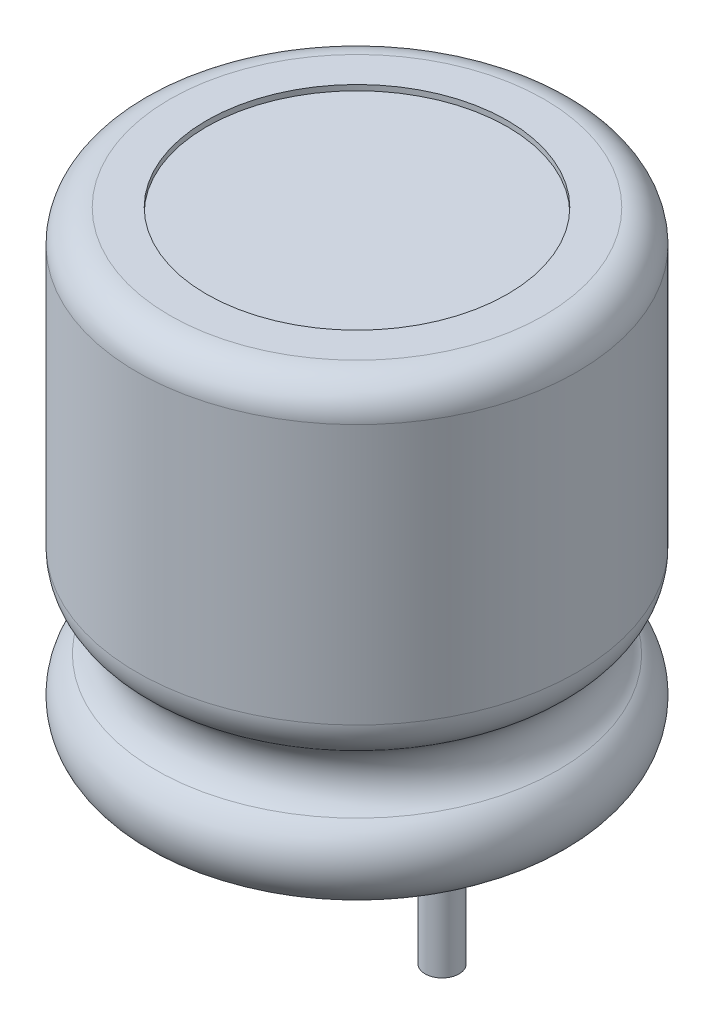
from build123d import *

# Parameters (mm, degrees)
SKETCH4_R              = 2.2
CUT_EXTRUDE1_DEPTH     = 0.33
BOSS_EXTRUDE1_DEPTH    = 0.5
CUT_EXTRUDE2_START     = -0.3
CUT_EXTRUDE2_DEPTH     = 0.3
SKETCH7_R              = 0.605
CUT_EXTRUDE3_DEPTH     = 0.6
SKETCH8_R              = 0.6
BOSS_EXTRUDE2_DEPTH    = 0.6
CHAMFER1_SIZE          = 0.35
SKETCH9_R              = 0.25
BOSS_EXTRUDE3_DEPTH    = 2.5
SKETCH10_R             = 3.23
BOSS_EXTRUDE4_DEPTH    = 4
FILLET1_R              = 0.48
SKETCH11_R             = 2.21
CUT_EXTRUDE4_DEPTH     = 0.08
SPLIT1_SURFACE_1_BACK  = 13.824
SPLIT1_SURFACE_1_DEPTH = 27.648
SPLIT1_SURFACE_2_BACK  = 13.824
SPLIT1_SURFACE_2_DEPTH = 27.648


with BuildPart() as part:
    # Sketch3 → Revolve1 (revolve)
    with BuildSketch(Plane.XY, mode=Mode.PRIVATE) as revolve1_sk:
        with BuildLine():
            Line((2.599137675, 0.17), (0, 0.17))
            Line((0, 0.17), (0, 3))
            Line((0, 3), (3.23, 3))
            Line((3.23, 3), (3.23, 2.699137675))
            ThreePointArc((3.23, 2.699137675), (3.157289203, 2.405106817), (2.955917553, 2.178853721))
            ThreePointArc((2.955917553, 2.178853721), (2.73, 1.75), (2.955917553, 1.321146279))
            ThreePointArc((2.955917553, 1.321146279), (3.201721618, 0.614100808), (2.599137675, 0.17))
        make_face()
    revolve(revolve1_sk.sketch.rotate(Axis((0, 3, 0), (0, -1, 0)), 180), axis=Axis((0, 3, 0), (0, -1, 0)))

    # Sketch4 → Cut-Extrude1 (cut)
    with BuildSketch(Plane.XZ.offset(-0.17)):
        Circle(SKETCH4_R)
    extrude(amount=-CUT_EXTRUDE1_DEPTH, mode=Mode.SUBTRACT)

    # Sketch5 → Boss-Extrude1 (add)
    with BuildSketch(Plane.XZ.offset(-0.5)):
        with BuildLine():
            ThreePointArc((1.3, 1.519868415), (0, 2), (-1.3, 1.519868415))
            ThreePointArc((-1.3, 1.519868415), (-1.391785902, 1.203832227), (-1.138461538, 0.993760118))
            ThreePointArc((-1.138461538, 0.993760118), (-0.25, 0), (-1.138461538, -0.993760118))
            ThreePointArc((-1.138461538, -0.993760118), (-1.391785902, -1.203832227), (-1.3, -1.519868415))
            ThreePointArc((-1.3, -1.519868415), (0, -2), (1.3, -1.519868415))
            ThreePointArc((1.3, -1.519868415), (1.391785902, -1.203832227), (1.138461538, -0.993760118))
            ThreePointArc((1.138461538, -0.993760118), (0.25, 0), (1.138461538, 0.993760118))
            ThreePointArc((1.138461538, 0.993760118), (1.391785902, 1.203832227), (1.3, 1.519868415))
        make_face()
    extrude(amount=BOSS_EXTRUDE1_DEPTH)

    # Sketch6 → Cut-Extrude2 (cut)
    with BuildSketch(Plane.XZ.offset(CUT_EXTRUDE2_START)):
        with BuildLine():
            Line((0.383974596, -0.5), (-0.383974596, -0.5))
            ThreePointArc((-0.383974596, -0.5), (-0.25, 0), (-0.383974596, 0.5))
            Line((-0.383974596, 0.5), (0.383974596, 0.5))
            ThreePointArc((0.383974596, 0.5), (0.25, 0), (0.383974596, -0.5))
        make_face()
    extrude(amount=CUT_EXTRUDE2_DEPTH, mode=Mode.SUBTRACT)

    # Sketch7 → Cut-Extrude3 (cut)
    with BuildSketch(Plane.XZ.offset(-0.5)):
        with Locations((-1.25, 0)):
            Circle(SKETCH7_R)
        with Locations((1.25, 0)):
            Circle(SKETCH7_R)
    extrude(amount=-CUT_EXTRUDE3_DEPTH, mode=Mode.SUBTRACT)

    # Sketch8 → Boss-Extrude2 (add)
    with BuildSketch(Plane.XZ.offset(-1.1)):
        with Locations((-1.25, 0)):
            Circle(SKETCH8_R)
        with Locations((1.25, 0)):
            Circle(SKETCH8_R)
    extrude(amount=BOSS_EXTRUDE2_DEPTH)

    # Chamfer1
    chamfer1_edges = [part.edges().sort_by_distance(p)[0] for p in [
        (-1.85, 0.5, 0),
        (0.65, 0.5, 0),
    ]]
    chamfer(chamfer1_edges, length=CHAMFER1_SIZE)

    # Sketch9 → Boss-Extrude3 (add)
    with BuildSketch(Plane.XZ.offset(-0.5)):
        with Locations((-1.25, 0)):
            Circle(SKETCH9_R)
        with Locations((1.25, 0)):
            Circle(SKETCH9_R)
    extrude(amount=BOSS_EXTRUDE3_DEPTH)

    # Sketch10 → Boss-Extrude4 (add)
    with BuildSketch(Plane(origin=(0, 3, 0), x_dir=(1, 0, 0), z_dir=(0, 1, 0))):
        with Locations(Location((0, 0, 0), (0, 0, 180))):
            Circle(SKETCH10_R)
    extrude(amount=BOSS_EXTRUDE4_DEPTH)

    # Fillet1
    fillet1_edges = [part.edges().sort_by_distance(p)[0] for p in [
        (3.23, 7, 0),
    ]]
    fillet(fillet1_edges, radius=FILLET1_R)

    # Sketch11 → Cut-Extrude4 (cut)
    with BuildSketch(Plane(origin=(0, 7, 0), x_dir=(1, 0, 0), z_dir=(0, 1, 0))):
        with Locations(Location((0, 0, 0), (0, 0, 180))):
            Circle(SKETCH11_R)
    extrude(amount=-CUT_EXTRUDE4_DEPTH, mode=Mode.SUBTRACT)


with BuildPart() as body_2:
    # Split1: the piece behind the surface
    add(part.part)
    # Split1 surface: a surface, the sketch's curves swept straight by 27.648 mm
    with BuildLine(Plane(origin=(5, 0, 0), x_dir=(0, 0, -1), z_dir=(1, 0, 0)).offset(-SPLIT1_SURFACE_1_BACK), mode=Mode.PRIVATE) as split1_surface_1_path:
        Line((-1, 0), (1, 0))
        Line((1, 0), (1, 7))
        Line((1, 7), (-1, 7))
        Line((-1, 7), (-1, 0))
    split1_surface_1 = Shell.extrude(split1_surface_1_path.wire(), (1 * SPLIT1_SURFACE_1_DEPTH, 0 * SPLIT1_SURFACE_1_DEPTH, 0 * SPLIT1_SURFACE_1_DEPTH))
    split(bisect_by=split1_surface_1, keep=Keep.BOTTOM)


with BuildPart() as part_1:
    add(part.part)

    # Split1: split by a surface, the side it looks to stays
    # Split1 surface: a surface, the sketch's curves swept straight by 27.648 mm
    with BuildLine(Plane(origin=(5, 0, 0), x_dir=(0, 0, -1), z_dir=(1, 0, 0)).offset(-SPLIT1_SURFACE_2_BACK), mode=Mode.PRIVATE) as split1_surface_2_path:
        Line((-1, 0), (1, 0))
        Line((1, 0), (1, 7))
        Line((1, 7), (-1, 7))
        Line((-1, 7), (-1, 0))
    split1_surface_2 = Shell.extrude(split1_surface_2_path.wire(), (1 * SPLIT1_SURFACE_2_DEPTH, 0 * SPLIT1_SURFACE_2_DEPTH, 0 * SPLIT1_SURFACE_2_DEPTH))
    split(bisect_by=split1_surface_2, keep=Keep.TOP)

    # Combine1: read off the stored shape, not the designer's step
    # Combine1: union body 2
    add(body_2.part)


solid = part_1.part
